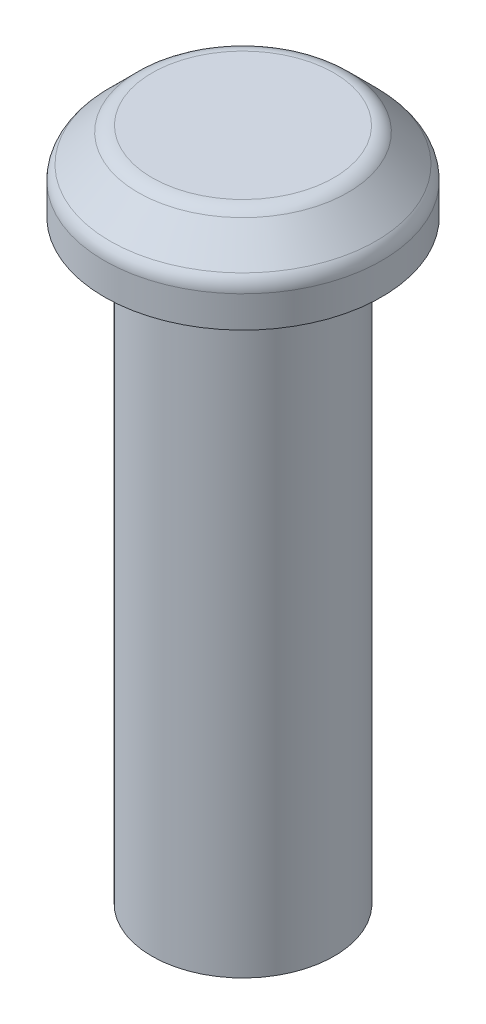
from build123d import *

# Parameters (mm, degrees)
SKETCH1_R           = 2.3
BOSS_EXTRUDE1_DEPTH = 15
SKETCH2_R           = 3.5
BOSS_EXTRUDE2_DEPTH = 2
CHAMFER1_SIZE       = 1
FILLET1_R           = 0.5


with BuildPart() as part:
    # Sketch1 → Boss-Extrude1 (new body)
    with BuildSketch(Plane(origin=(0, 0, 0), x_dir=(1, 0, 0), z_dir=(0, 1, 0))):
        Circle(SKETCH1_R)
    extrude(amount=BOSS_EXTRUDE1_DEPTH)

    # Sketch2 → Boss-Extrude2 (add)
    with BuildSketch(Plane(origin=(0, 15, 0), x_dir=(1, 0, 0), z_dir=(0, 1, 0))):
        Circle(SKETCH2_R)
    extrude(amount=BOSS_EXTRUDE2_DEPTH)

    # Chamfer1
    chamfer1_edges = [part.edges().sort_by_distance(p)[0] for p in [
        (-3.5, 17, 0),
    ]]
    chamfer(chamfer1_edges, length=CHAMFER1_SIZE)

    # Fillet1
    fillet1_edges = [part.edges().sort_by_distance(p)[0] for p in [
        (-2.5, 17, 0),
        (-3.5, 16, 0),
    ]]
    fillet(fillet1_edges, radius=FILLET1_R)


solid = part.part
